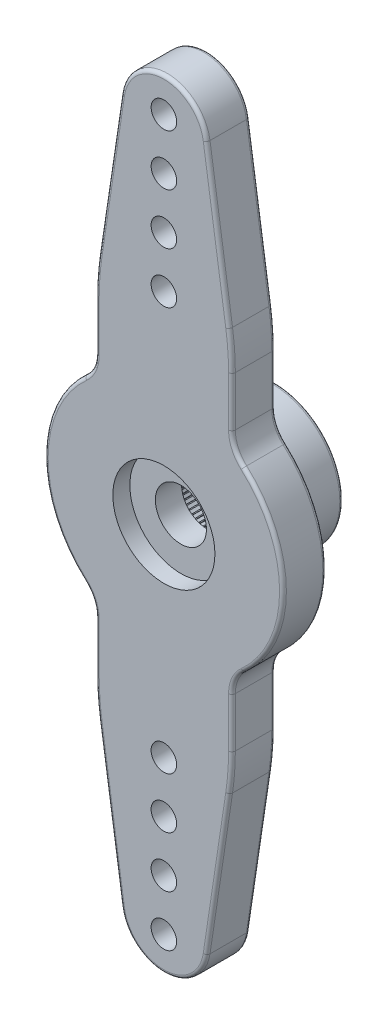
from build123d import *

# Parameters (mm, degrees)
SKETCH1_R                = 7
SKETCH1_R_2              = 1.5
SKETCH1_R_3              = 2.54
BOSS_EXTRUDE1_DEPTH      = 2.54
FILLET1_R                = 15
SKETCH2_R                = 0.75
CUT_EXTRUDE1_DEPTH       = 25.042279426
CIRPATTERN2_COUNT        = 2
FILLET1_OF_CIRPATTERN2_R = 15
FILLET2_R                = 2
SKETCH3_R                = 3
CUT_EXTRUDE2_DEPTH       = 1
SKETCH4_R                = 4
SKETCH4_R_2              = 3
BOSS_EXTRUDE2_DEPTH      = 4
SKETCH5_W                = 0.05
SKETCH5_H                = 0.5
BOSS_EXTRUDE3_DEPTH      = 4
CIRPATTERN3_COUNT        = 80
FILLET3_R                = 0.2


with BuildPart() as part:
    # Sketch1 → Boss-Extrude1 (new body)
    # profile 1 of 3: a face of its own
    with BuildSketch(Plane.XY):
        Circle(SKETCH1_R)
        Circle(SKETCH1_R_2, mode=Mode.SUBTRACT)
    # profile 2 of 3: a face of its own
    with BuildSketch(Plane.XY):
        with BuildLine():
            Line((-2.512073283, 20.69561659), (-4, 10.744562647))
            Line((-4, 10.744562647), (-4, 5.744562647))
            ThreePointArc((-4, 5.744562647), (0, 7), (4, 5.744562647))
            Line((4, 5.744562647), (4, 10.744562647))
            Line((4, 10.744562647), (2.512073283, 20.69561659))
            ThreePointArc((2.512073283, 20.69561659), (2.533008699, 20.508326661), (2.54, 20.32))
            ThreePointArc((2.54, 20.32), (-0.188326661, 17.786991301), (-2.512073283, 20.69561659))
        make_face()
    # profile 3 of 3: a face of its own
    with BuildSketch(Plane.XY):
        with Locations((0, 20.32)):
            Circle(SKETCH1_R_3)
    boss_extrude1 = extrude(amount=BOSS_EXTRUDE1_DEPTH)

    # Fillet1
    fillet1_edges = [part.edges().sort_by_distance(p)[0] for p in [
        (-4, 10.744562647, 1.27),
        (4, 10.744562647, 1.27),
    ]]
    fillet(fillet1_edges, radius=FILLET1_R)

    # Sketch2 → Cut-Extrude1 (cut, through all)
    with BuildSketch(Plane.XY.offset(2.54)):
        with Locations((0, 20.86)):
            Circle(SKETCH2_R)
        with Locations((0, 17.86)):
            Circle(SKETCH2_R)
        with Locations((0, 14.86)):
            Circle(SKETCH2_R)
        with Locations((0, 11.86)):
            Circle(SKETCH2_R)
    cut_extrude1 = extrude(amount=-CUT_EXTRUDE1_DEPTH, mode=Mode.SUBTRACT)

    # CirPattern2: Boss-Extrude1, Cut-Extrude1 ×2 about axis
    cirpattern2_axis = Axis((0, 0, 0), (0, 0, 1))
    add([boss_extrude1.rotate(cirpattern2_axis, i * 360 / CIRPATTERN2_COUNT) for i in range(1, CIRPATTERN2_COUNT)])
    add([cut_extrude1.rotate(cirpattern2_axis, i * 360 / CIRPATTERN2_COUNT) for i in range(1, CIRPATTERN2_COUNT)], mode=Mode.SUBTRACT)

    # Fillet1 of CirPattern2
    fillet1_of_cirpattern2_edges = [part.edges().sort_by_distance(p)[0] for p in [
        (4, -10.744562647, 1.27),
        (-4, -10.744562647, 1.27),
    ]]
    fillet(fillet1_of_cirpattern2_edges, radius=FILLET1_OF_CIRPATTERN2_R)

    # Fillet2
    fillet2_edges = [part.edges().sort_by_distance(p)[0] for p in [
        (-4, 5.744562647, 1.27),
        (4, 5.744562647, 1.27),
        (4, -5.744562647, 1.27),
        (-4, -5.744562647, 1.27),
    ]]
    fillet(fillet2_edges, radius=FILLET2_R)

    # Sketch3 → Cut-Extrude2 (cut)
    with BuildSketch(Plane.XY.offset(2.54)):
        Circle(SKETCH3_R)
    extrude(amount=-CUT_EXTRUDE2_DEPTH, mode=Mode.SUBTRACT)

    # Sketch4 → Boss-Extrude2 (add)
    with BuildSketch(Plane(origin=(0, 0, 0), x_dir=(-1, 0, 0), z_dir=(0, 0, -1))):
        with Locations(Location((0, 0, 0), (0, 0, 180))):
            Circle(SKETCH4_R)
        with Locations(Location((0, 0, 0), (0, 0, 180))):
            Circle(SKETCH4_R_2, mode=Mode.SUBTRACT)
    extrude(amount=BOSS_EXTRUDE2_DEPTH)

    # Sketch5 → Boss-Extrude3 (add)
    with BuildSketch(Plane(origin=(0, 0, -4), x_dir=(-1, 0, 0), z_dir=(0, 0, -1))):
        with Locations((0, -3.144105088)):
            Rectangle(SKETCH5_W, SKETCH5_H)
    boss_extrude3 = extrude(amount=-BOSS_EXTRUDE3_DEPTH)

    # CirPattern3: Boss-Extrude3 ×80 about axis
    cirpattern3_axis = Axis((0, 0, 0), (0, 0, 1))
    for i in range(1, CIRPATTERN3_COUNT):
        add(boss_extrude3.rotate(cirpattern3_axis, i * 360 / CIRPATTERN3_COUNT))

    # Fillet3
    fillet3_edges = [part.edges().sort_by_distance(p)[0] for p in [
        (3.173575861, 16.271576233, 0),
        (-7, 0, 0),
        (-7, 0, 2.54),
        (7, 0, 0),
        (7, 0, 2.54),
        (-4.174258142, 5.891707352, 0),
        (-4.174258142, 5.891707352, 2.54),
        (-4.174258142, -5.891707352, 0),
        (-4.174258142, -5.891707352, 2.54),
        (4.174258142, -5.891707352, 0),
        (4.174258142, -5.891707352, 2.54),
        (4.174258142, 5.891707352, 0),
        (4.174258142, 5.891707352, 2.54),
        (-4, 0, 0),
        (-4, 0, -4),
        (3.173575861, 16.271576233, 2.54),
        (-4, 8.168765799, 0),
        (0, 22.86, 2.54),
        (-4, 8.168765799, 2.54),
        (4, 8.168765799, 0),
        (3.958712789, 10.741492984, 0),
        (-3.958712789, 10.741492984, 0),
        (4, 8.168765799, 2.54),
        (3.958712789, 10.741492984, 2.54),
        (-3.173575861, 16.271576233, 2.54),
        (-3.958712789, 10.741492984, 2.54),
        (0, -22.86, 2.54),
        (3.173575861, -16.271576233, 2.54),
        (-3.173575861, -16.271576233, 0),
        (-3.173575861, -16.271576233, 2.54),
        (0, -22.86, 0),
        (3.173575861, -16.271576233, 0),
        (4, -8.168765799, 0),
        (4, -8.168765799, 2.54),
        (-4, -8.168765799, 0),
        (-3.958712789, -10.741492984, 0),
        (3.958712789, -10.741492984, 0),
        (-4, -8.168765799, 2.54),
        (-3.958712789, -10.741492984, 2.54),
        (3.958712789, -10.741492984, 2.54),
        (-3.173575861, 16.271576233, 0),
        (0, 22.86, 0),
    ]]
    fillet(fillet3_edges, radius=FILLET3_R)


solid = part.part
